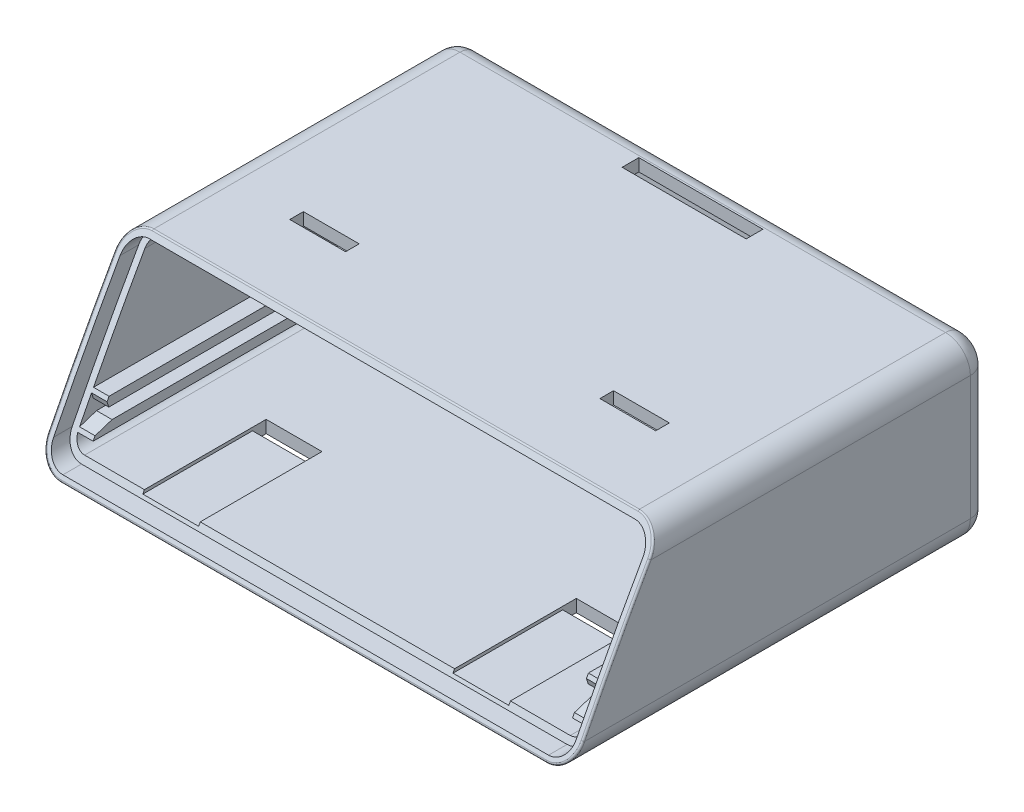
from build123d import *

# Parameters (mm, degrees)
SKETCH1_W                = 86.28
SKETCH1_H                = 67.5
BOSS_EXTRUDE1_DEPTH      = 28
FILLET1_R                = 4
SHELL1_T                 = -2
CUT_EXTRUDE1_DEPTH       = 97.784817508
SKETCH3_W                = 14.3
SKETCH3_H                = 16.7
SKETCH3_W_2              = 11.05
SKETCH3_H_2              = 14.049996967
CUT_EXTRUDE2_DEPTH       = 2
FILLET2_R                = 3
CUT_EXTRUDE3_REACH       = 165.279
CUT_EXTRUDE3_END_RADIUS  = 475
CUT_EXTRUDE3_START       = 80
FILLET3_R                = 0.3
BOSS_EXTRUDE2_REACH      = 85.135
BOSS_EXTRUDE2_END_RADIUS = 475
SKETCH5_W                = 2.5
SKETCH5_H                = 1.5
SKETCH6_W                = 9
SKETCH6_H                = 2.2
CUT_EXTRUDE4_DEPTH       = 2
SKETCH9_W                = 9
SKETCH9_H                = 2.2
CUT_EXTRUDE7_DEPTH       = 2
SKETCH7_W                = 20
SKETCH7_H                = 2.4
CUT_EXTRUDE5_DEPTH       = 2
SKETCH8_W                = 9
SKETCH8_H                = 0.5
CUT_EXTRUDE6_DEPTH       = 66.203266898
SKETCH10_W               = 9
SKETCH10_H               = 0.5
CUT_EXTRUDE8_DEPTH       = 70.05379073
SKETCH11_W               = 2.84
SKETCH11_H               = 2
SKETCH11_W_2             = 33.99
SKETCH11_W_3             = 20.1
BOSS_EXTRUDE3_DEPTH      = 0.5
CHAMFER1_SIZE2           = 2.284662113
CHAMFER1_SIZE            = 1
CHAMFER1_EDGE_2_SIZE2    = 0.742484525
CHAMFER1_EDGE_2_SIZE     = 1
CHAMFER1_EDGE_3_SIZE2    = 0.742484525
CHAMFER1_EDGE_3_SIZE     = 1
CHAMFER1_EDGE_4_SIZE2    = 2.284662113
CHAMFER1_EDGE_4_SIZE     = 1
SKETCH12_W               = 20
SKETCH12_H               = 2
CUT_EXTRUDE9_DEPTH       = 0.3


with BuildPart() as part:
    # Sketch1 → Boss-Extrude1 (new body)
    with BuildSketch(Plane(origin=(0, 0, 0), x_dir=(1, 0, 0), z_dir=(0, 1, 0))):
        Rectangle(SKETCH1_W, SKETCH1_H)
    extrude(amount=BOSS_EXTRUDE1_DEPTH)

    # Fillet1
    fillet1_edges = [part.edges().sort_by_distance(p)[0] for p in [
        (-43.14, 28, 0),
        (43.14, 28, 0),
        (-43.14, 0, 0),
        (43.14, 0, 0),
    ]]
    fillet(fillet1_edges, radius=FILLET1_R)

    # Shell1
    shell1_openings = [part.faces().sort_by_distance(p)[0] for p in [
        (0, 14, 33.75),
    ]]
    offset(amount=SHELL1_T, openings=shell1_openings, kind=Kind.INTERSECTION)

    # Sketch2 → Cut-Extrude1 (cut, through all)
    with BuildSketch(Plane.ZY.offset(43.14)):
        with BuildLine():
            Line((18.75, 28), (33.75, 28))
            Line((33.75, 28), (33.75, 0))
            ThreePointArc((33.75, 0), (26.484121584, 14.125422277), (18.75, 28))
        make_face()
    extrude(amount=-CUT_EXTRUDE1_DEPTH, mode=Mode.SUBTRACT)

    # Sketch3 → Cut-Extrude2 (cut)
    with BuildSketch(Plane(origin=(0, 0, -33.75), x_dir=(-1, 0, 0), z_dir=(0, 0, -1))):
        with Locations((0, 10.35)):
            Rectangle(SKETCH3_W, SKETCH3_H)
        with Locations((32.775, 10.175001517)):
            Rectangle(SKETCH3_W_2, SKETCH3_H_2)
    extrude(amount=-CUT_EXTRUDE2_DEPTH, mode=Mode.SUBTRACT)

    # Fillet2
    # the kernel refuses this fillet: 3 mm, written as the material it takes off along each edge
    with BuildSketch(Plane(origin=(39.14, 24, -33.75), x_dir=(1, 0, 0), z_dir=(0, -1, 0))) as fillet2_piece_1:
        with BuildLine():
            CenterArc((4 - FILLET2_R, FILLET2_R), FILLET2_R, 270, 90)
            Line((4, FILLET2_R), (4, 0))
            Line((4, 0), (4 - FILLET2_R, 0))
        make_face()
    revolve(axis=Axis((39.14, 24, -33.75), (0, 0, 1)), revolution_arc=90, mode=Mode.SUBTRACT)
    with BuildSketch(Plane(origin=(43.14, 4, -33.75), x_dir=(-1, 0, 0), z_dir=(0, 1, 0)), Plane(origin=(-43.14, 4, -33.75), x_dir=(0, 0, 1), z_dir=(0, 1, 0))) as fillet2_piece_2:
        with BuildLine():
            CenterArc((FILLET2_R, FILLET2_R), FILLET2_R, 180, 90)
            Line((0, FILLET2_R), (0, 0))
            Line((0, 0), (FILLET2_R, 0))
        make_face()
    extrude(amount=20, mode=Mode.SUBTRACT)
    with BuildSketch(Plane(origin=(39.14, 4, -33.75), x_dir=(1, 0, 0), z_dir=(0, 1, 0))) as fillet2_piece_3:
        with BuildLine():
            CenterArc((4 - FILLET2_R, -FILLET2_R), FILLET2_R, 0, 90)
            Line((4, -FILLET2_R), (4, 0))
            Line((4, 0), (4 - FILLET2_R, 0))
        make_face()
    revolve(axis=Axis((39.14, 4, -33.75), (0, 0, -1)), revolution_arc=90, mode=Mode.SUBTRACT)
    with BuildSketch(Plane(origin=(39.14, 0, -33.75), x_dir=(0, 1, 0), z_dir=(-1, 0, 0))) as fillet2_piece_4:
        with BuildLine():
            CenterArc((FILLET2_R, -FILLET2_R), FILLET2_R, 90, 90)
            Line((0, -FILLET2_R), (0, 0))
            Line((0, 0), (FILLET2_R, 0))
        make_face()
    extrude(amount=78.28, mode=Mode.SUBTRACT)
    with BuildSketch(Plane(origin=(-39.14, 4, -33.75), x_dir=(-1, 0, 0), z_dir=(0, 1, 0))) as fillet2_piece_5:
        with BuildLine():
            CenterArc((4 - FILLET2_R, FILLET2_R), FILLET2_R, 270, 90)
            Line((4 - FILLET2_R, 0), (4, 0))
            Line((4, 0), (4, FILLET2_R))
        make_face()
    revolve(axis=Axis((-39.14, 4, -33.75), (0, 0, 1)), revolution_arc=90, mode=Mode.SUBTRACT)
    with BuildSketch(Plane(origin=(-39.14, 24, -33.75), x_dir=(-1, 0, 0), z_dir=(0, -1, 0))) as fillet2_piece_6:
        with BuildLine():
            CenterArc((4 - FILLET2_R, -FILLET2_R), FILLET2_R, 0, 90)
            Line((4 - FILLET2_R, 0), (4, 0))
            Line((4, 0), (4, -FILLET2_R))
        make_face()
    revolve(axis=Axis((-39.14, 24, -33.75), (0, 0, -1)), revolution_arc=90, mode=Mode.SUBTRACT)
    with BuildSketch(Plane(origin=(39.14, 28, -33.75), x_dir=(0, -1, 0), z_dir=(-1, 0, 0))) as fillet2_piece_7:
        with BuildLine():
            CenterArc((FILLET2_R, FILLET2_R), FILLET2_R, 180, 90)
            Line((0, FILLET2_R), (0, 0))
            Line((0, 0), (FILLET2_R, 0))
        make_face()
    extrude(amount=78.28, mode=Mode.SUBTRACT)

    # Cut-Extrude3: up to this cylinder (the profile starts outside it)
    cut_extrude3_end = Plane(origin=(-23.145, -210.179748667, -395.218864179), z_dir=(-1, 0, 0)) * Cylinder(CUT_EXTRUDE3_END_RADIUS, 1281.558, mode=Mode.PRIVATE)
    # Sketch4 → Cut-Extrude3 (cut, up to the surface)
    with BuildSketch(Plane.XY.offset(-31.75).offset(CUT_EXTRUDE3_START), mode=Mode.PRIVATE) as cut_extrude3_sk1:
        with BuildLine():
            Line((-7.15, 1), (7.15, 1))
            Line((7.15, 1), (39.14, 1))
            ThreePointArc((39.14, 1), (41.261320344, 1.878679656), (42.14, 4))
            Line((42.14, 4), (42.14, 24))
            ThreePointArc((42.14, 24), (41.261320344, 26.121320344), (39.14, 27))
            Line((39.14, 27), (-39.14, 27))
            ThreePointArc((-39.14, 27), (-41.261320344, 26.121320344), (-42.14, 24))
            Line((-42.14, 24), (-42.14, 4))
            ThreePointArc((-42.14, 4), (-41.261320344, 1.878679656), (-39.14, 1))
            Line((-39.14, 1), (-7.15, 1))
        make_face()
        with BuildLine():
            Line((-7.15, 2), (7.15, 2))
            Line((7.15, 2), (39.14, 2))
            ThreePointArc((39.14, 2), (40.554213562, 2.585786438), (41.14, 4))
            Line((41.14, 4), (41.14, 24))
            ThreePointArc((41.14, 24), (40.554213562, 25.414213562), (39.14, 26))
            Line((39.14, 26), (-39.14, 26))
            ThreePointArc((-39.14, 26), (-40.554213562, 25.414213562), (-41.14, 24))
            Line((-41.14, 24), (-41.14, 4))
            ThreePointArc((-41.14, 4), (-40.554213562, 2.585786438), (-39.14, 2))
            Line((-39.14, 2), (-7.15, 2))
        make_face(mode=Mode.SUBTRACT)
    cut_extrude3_tool1 = extrude(cut_extrude3_sk1.sketch, amount=-CUT_EXTRUDE3_REACH, mode=Mode.PRIVATE) - cut_extrude3_end
    add(cut_extrude3_tool1.solids().sort_by_distance((-23.145, 1.881993, 48.25))[0], mode=Mode.SUBTRACT)

    # Fillet3
    fillet3_edges = [part.edges().sort_by_distance(p)[0] for p in [
        (0, 0, 33.75),
        (-43.14, 14.0639546, 26.517044891),
        (42.064985447, 26.728453829, 19.484309952),
        (42.046759663, 1.252137501, 33.12988391),
        (-42.046759662, 1.252137501, 33.12988391),
        (-42.064985447, 26.728453829, 19.484309952),
        (43.14, 14.0639546, 26.517044891),
        (0, 28, 18.75),
    ]]
    fillet(fillet3_edges, radius=FILLET3_R)

    # Boss-Extrude2: up to this cylinder (the profile starts inside it)
    boss_extrude2_end = Plane(origin=(0, -210.179748667, -395.218864179), z_dir=(-1, 0, 0)) * Cylinder(BOSS_EXTRUDE2_END_RADIUS, 1201.05, mode=Mode.PRIVATE)
    # Sketch5 → Boss-Extrude2 (add, up to the surface)
    with BuildSketch(Plane.XY.offset(-31.75), mode=Mode.PRIVATE) as boss_extrude2_sk1:
        with Locations((39.89, 4.5)):
            Rectangle(SKETCH5_W, SKETCH5_H)
    boss_extrude2_tool1 = extrude(boss_extrude2_sk1.sketch, amount=BOSS_EXTRUDE2_REACH, mode=Mode.PRIVATE) & boss_extrude2_end
    add(boss_extrude2_tool1.solids().sort_by_distance((39.89, 4.5, -31.75))[0])
    # Sketch5 → Boss-Extrude2 (add, up to the surface)
    with BuildSketch(Plane.XY.offset(-31.75), mode=Mode.PRIVATE) as boss_extrude2_sk2:
        with Locations((39.89, 8)):
            Rectangle(SKETCH5_W, SKETCH5_H)
    boss_extrude2_tool2 = extrude(boss_extrude2_sk2.sketch, amount=BOSS_EXTRUDE2_REACH, mode=Mode.PRIVATE) & boss_extrude2_end
    add(boss_extrude2_tool2.solids().sort_by_distance((39.89, 8, -31.75))[0])
    # Sketch5 → Boss-Extrude2 (add, up to the surface)
    with BuildSketch(Plane.XY.offset(-31.75), mode=Mode.PRIVATE) as boss_extrude2_sk3:
        with Locations((-39.89, 8)):
            Rectangle(SKETCH5_W, SKETCH5_H)
    boss_extrude2_tool3 = extrude(boss_extrude2_sk3.sketch, amount=BOSS_EXTRUDE2_REACH, mode=Mode.PRIVATE) & boss_extrude2_end
    add(boss_extrude2_tool3.solids().sort_by_distance((-39.89, 8, -31.75))[0])
    # Sketch5 → Boss-Extrude2 (add, up to the surface)
    with BuildSketch(Plane.XY.offset(-31.75), mode=Mode.PRIVATE) as boss_extrude2_sk4:
        with Locations((-39.89, 4.5)):
            Rectangle(SKETCH5_W, SKETCH5_H)
    boss_extrude2_tool4 = extrude(boss_extrude2_sk4.sketch, amount=BOSS_EXTRUDE2_REACH, mode=Mode.PRIVATE) & boss_extrude2_end
    add(boss_extrude2_tool4.solids().sort_by_distance((-39.89, 4.5, -31.75))[0])

    # Sketch6 → Cut-Extrude4 (cut)
    with BuildSketch(Plane(origin=(0, 28, 0), x_dir=(1, 0, 0), z_dir=(0, 1, 0))):
        with Locations((25, -5.23)):
            Rectangle(SKETCH6_W, SKETCH6_H)
        with Locations((-25, -5.23)):
            Rectangle(SKETCH6_W, SKETCH6_H)
    extrude(amount=-CUT_EXTRUDE4_DEPTH, mode=Mode.SUBTRACT)

    # Sketch9 → Cut-Extrude7 (cut)
    with BuildSketch(Plane.XZ):
        with Locations((-25, 11.23)):
            Rectangle(SKETCH9_W, SKETCH9_H)
        with Locations((25, 11.23)):
            Rectangle(SKETCH9_W, SKETCH9_H)
    extrude(amount=-CUT_EXTRUDE7_DEPTH, mode=Mode.SUBTRACT)

    # Sketch7 → Cut-Extrude5 (cut)
    with BuildSketch(Plane(origin=(0, 28, 0), x_dir=(1, 0, 0), z_dir=(0, 1, 0))):
        with Locations((0, 28.95)):
            Rectangle(SKETCH7_W, SKETCH7_H)
    extrude(amount=-CUT_EXTRUDE5_DEPTH, mode=Mode.SUBTRACT)

    # Sketch8 → Cut-Extrude6 (cut, through all)
    with BuildSketch(Plane(origin=(0, 0, 6.33), x_dir=(-1, 0, 0), z_dir=(0, 0, -1))):
        with Locations((25, 26.25)):
            Rectangle(SKETCH8_W, SKETCH8_H)
        with Locations((-25, 26.25)):
            Rectangle(SKETCH8_W, SKETCH8_H)
    extrude(amount=-CUT_EXTRUDE6_DEPTH, mode=Mode.SUBTRACT)

    # Sketch10 → Cut-Extrude8 (cut, through all)
    with BuildSketch(Plane(origin=(0, 0, 12.33), x_dir=(-1, 0, 0), z_dir=(0, 0, -1))):
        with Locations((25, 1.75)):
            Rectangle(SKETCH10_W, SKETCH10_H)
        with Locations((-25, 1.75)):
            Rectangle(SKETCH10_W, SKETCH10_H)
    extrude(amount=-CUT_EXTRUDE8_DEPTH, mode=Mode.SUBTRACT)

    # Sketch11 → Boss-Extrude3 (add)
    with BuildSketch(Plane.XY.offset(-31.75)):
        with Locations((-39.72, 6.25)):
            Rectangle(SKETCH11_W, SKETCH11_H)
        with Locations((24.145, 6.25)):
            Rectangle(SKETCH11_W_2, SKETCH11_H)
        with Locations((-17.2, 6.25)):
            Rectangle(SKETCH11_W_3, SKETCH11_H)
    extrude(amount=BOSS_EXTRUDE3_DEPTH)

    # Chamfer1
    chamfer1_edges = [part.edges().sort_by_distance(p)[0] for p in [
        (39.89, 5.25, 28.11908993),
    ]]
    chamfer(chamfer1_edges, length=CHAMFER1_SIZE, length2=CHAMFER1_SIZE2)

    # Chamfer1 edge 2
    chamfer1_edge_2_edges = [part.edges().sort_by_distance(p)[0] for p in [
        (39.89, 7.25, 27.095360533),
    ]]
    chamfer(chamfer1_edge_2_edges, length=CHAMFER1_EDGE_2_SIZE, length2=CHAMFER1_EDGE_2_SIZE2)

    # Chamfer1 edge 3
    chamfer1_edge_3_edges = [part.edges().sort_by_distance(p)[0] for p in [
        (-39.89, 7.25, 27.095360533),
    ]]
    chamfer(chamfer1_edge_3_edges, length=CHAMFER1_EDGE_3_SIZE, length2=CHAMFER1_EDGE_3_SIZE2)

    # Chamfer1 edge 4
    chamfer1_edge_4_edges = [part.edges().sort_by_distance(p)[0] for p in [
        (-39.89, 5.25, 28.11908993),
    ]]
    chamfer(chamfer1_edge_4_edges, length=CHAMFER1_EDGE_4_SIZE, length2=CHAMFER1_EDGE_4_SIZE2)

    # Sketch12 → Cut-Extrude9 (cut)
    with BuildSketch(Plane.XY.offset(-30.15)):
        with Locations((0, 27)):
            Rectangle(SKETCH12_W, SKETCH12_H)
    extrude(amount=-CUT_EXTRUDE9_DEPTH, mode=Mode.SUBTRACT)


solid = part.part
